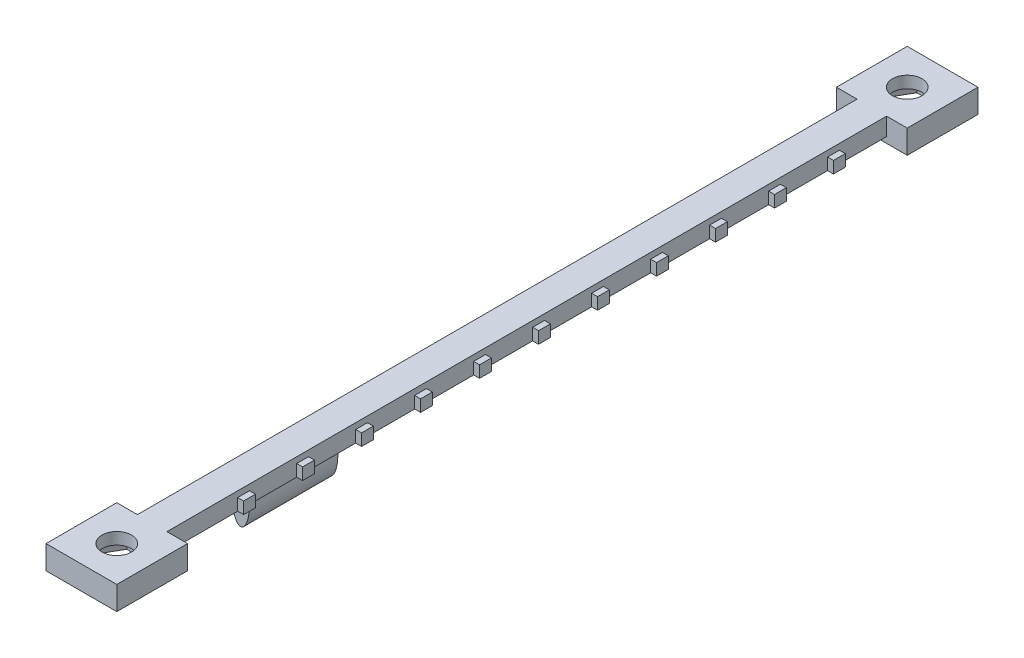
from build123d import *

# Parameters (mm, degrees)
BOSS_EXTRUDE1_DEPTH = 2
BOSS_EXTRUDE2_DEPTH = 1
SKETCH3_W           = 12
SKETCH3_H           = 12
BOSS_EXTRUDE3_DEPTH = 1
CUT_EXTRUDE1_DEPTH  = 2
SKETCH5_R           = 2.5
CUT_EXTRUDE2_DEPTH  = 5
SKETCH6_W           = 3
SKETCH6_H           = 15
BOSS_EXTRUDE4_DEPTH = 5
CUT_EXTRUDE3_DEPTH  = 30


with BuildPart() as part:
    # Sketch1 → Boss-Extrude1 (new body)
    with BuildSketch(Plane(origin=(0, 0, 0), x_dir=(1, 0, 0), z_dir=(0, 1, 0))):
        Polygon((7.22672382, 6.096), (7.22672382, 18.096), (6.22672382, 18.096), (6.22672382, 20.096), (7.22672382, 20.096), (7.22672382, 28.096), (6.22672382, 28.096), (6.22672382, 30.096), (7.22672382, 30.096), (7.22672382, 38.096), (6.22672382, 38.096), (6.22672382, 40.096), (7.22672382, 40.096), (7.22672382, 48.096), (6.22672382, 48.096), (6.22672382, 50.096), (7.22672382, 50.096), (7.22672382, 58.096), (6.22672382, 58.096), (6.22672382, 60.096), (7.22672382, 60.096), (7.22672382, 68.096), (6.22672382, 68.096), (6.22672382, 70.096), (7.22672382, 70.096), (7.22672382, 78.096), (6.22672382, 78.096), (6.22672382, 80.096), (7.22672382, 80.096), (7.22672382, 88.096), (6.22672382, 88.096), (6.22672382, 90.096), (7.22672382, 90.096), (7.22672382, 98.096), (6.22672382, 98.096), (6.22672382, 100.096), (7.22672382, 100.096), (7.22672382, 108.096), (6.22672382, 108.096), (6.22672382, 110.096), (7.22672382, 110.096), (7.22672382, 118.096), (6.22672382, 118.096), (6.22672382, 120.096), (7.22672382, 120.096), (7.22672382, 128.096), (3.72672382, 128.096), (3.72672382, 140.096), (15.72672382, 140.096), (15.72672382, 128.096), (12.22672382, 128.096), (12.22672382, 120.096), (13.22672382, 120.096), (13.22672382, 118.096), (12.22672382, 118.096), (12.22672382, 110.096), (13.226723821, 110.096), (13.226723821, 108.096), (12.22672382, 108.096), (12.22672382, 100.096), (13.226723821, 100.096), (13.226723821, 98.096), (12.22672382, 98.096), (12.22672382, 90.096), (13.226723821, 90.096), (13.226723821, 88.096), (12.22672382, 88.096), (12.22672382, 80.096), (13.226723821, 80.096), (13.226723821, 78.096), (12.22672382, 78.096), (12.22672382, 70.096), (13.226723821, 70.096), (13.226723821, 68.096), (12.22672382, 68.096), (12.22672382, 60.096), (13.226723821, 60.096), (13.226723821, 58.096), (12.22672382, 58.096), (12.22672382, 50.096), (13.226723821, 50.096), (13.226723821, 48.096), (12.22672382, 48.096), (12.22672382, 40.096), (13.226723821, 40.096), (13.226723821, 38.096), (12.22672382, 38.096), (12.22672382, 30.096), (13.226723821, 30.096), (13.226723821, 28.096), (12.22672382, 28.096), (12.22672382, 20.096), (13.226723821, 20.096), (13.226723821, 18.096), (12.22672382, 18.096), (12.22672382, 6.096), (15.72672382, 6.096), (15.72672382, -5.904), (3.72672382, -5.904), (3.72672382, 6.096), align=None)
    extrude(amount=BOSS_EXTRUDE1_DEPTH)

    # Sketch2 → Boss-Extrude2 (add)
    with BuildSketch(Plane(origin=(0, 2, 0), x_dir=(1, 0, 0), z_dir=(0, 1, 0))):
        Polygon((3.72672382, 140.096), (15.72672382, 140.096), (15.72672382, 128.096), (12.22672382, 128.096), (12.22672382, 6.096), (15.72672382, 6.096), (15.72672382, -5.904), (3.72672382, -5.904), (3.72672382, 6.096), (7.22672382, 6.096), (7.22672382, 128.096), (3.72672382, 128.096), align=None)
    extrude(amount=BOSS_EXTRUDE2_DEPTH)

    # Sketch3 → Boss-Extrude3 (add)
    with BuildSketch(Plane(origin=(0, 0, 0), x_dir=(-1, 0, 0), z_dir=(0, -1, 0))):
        with Locations((-9.72672382, 134.096)):
            Rectangle(SKETCH3_W, SKETCH3_H)
        with Locations((-9.72672382, 0.096)):
            Rectangle(SKETCH3_W, SKETCH3_H)
    extrude(amount=BOSS_EXTRUDE3_DEPTH)

    # Sketch4 → Cut-Extrude1 (cut)
    with BuildSketch(Plane(origin=(0, -1, 0), x_dir=(-1, 0, 0), z_dir=(0, -1, 0))):
        Polygon((-7.365059478, 138.096), (-11.983861632, 138.096), (-14.293262708, 134.096), (-11.983861632, 130.096), (-7.365059478, 130.096), (-5.055658401, 134.096), align=None)
        Polygon((-7.417322744, 4.096), (-12.036124897, 4.096), (-14.345525974, 0.096), (-12.036124897, -3.904), (-7.417322744, -3.904), (-5.107921667, 0.096), align=None)
    extrude(amount=-CUT_EXTRUDE1_DEPTH, mode=Mode.SUBTRACT)

    # Sketch5 → Cut-Extrude2 (cut)
    with BuildSketch(Plane(origin=(0, 1, 0), x_dir=(-1, 0, 0), z_dir=(0, -1, 0))):
        with Locations((-9.72672382, 0.096)):
            Circle(SKETCH5_R)
        with Locations((-9.72672382, 134.096)):
            Circle(SKETCH5_R)
    extrude(amount=-CUT_EXTRUDE2_DEPTH, mode=Mode.SUBTRACT)

    # Sketch6 → Boss-Extrude4 (add)
    with BuildSketch(Plane(origin=(0, 0, 0), x_dir=(-1, 0, 0), z_dir=(0, -1, 0))):
        with Locations((-9.72672382, 28.596)):
            Rectangle(SKETCH6_W, SKETCH6_H)
    extrude(amount=BOSS_EXTRUDE4_DEPTH)

    # Sketch7 → Cut-Extrude3 (cut)
    with BuildSketch(Plane(origin=(0, 0, -36.096), x_dir=(-1, 0, 0), z_dir=(0, 0, -1))):
        with BuildLine():
            Line((-9.72672381, -5), (-8.22672382, -5))
            Line((-8.22672382, -5), (-8.22672382, -1))
            add(Edge.make_bspline(
                [(-9.72672382, -5), (-8.22672382, -5), (-8.22672382, -1)],
                knots=[6.283185307, 6.283185307, 6.283185307, 7.853981634, 7.853981634, 7.853981634], degree=2, weights=[1, 0.707106781, 1]))
        make_face()
        with BuildLine():
            Line((-11.22672382, -5), (-9.72672381, -5))
            add(Edge.make_bspline(
                [(-11.22672382, -1), (-11.22672382, -5), (-9.72672382, -5)],
                knots=[4.71238898, 4.71238898, 4.71238898, 6.283185307, 6.283185307, 6.283185307], degree=2, weights=[1, 0.707106781, 1]))
            Line((-11.22672382, -1), (-11.22672382, -5))
        make_face()
    extrude(amount=-CUT_EXTRUDE3_DEPTH, mode=Mode.SUBTRACT)


solid = part.part
